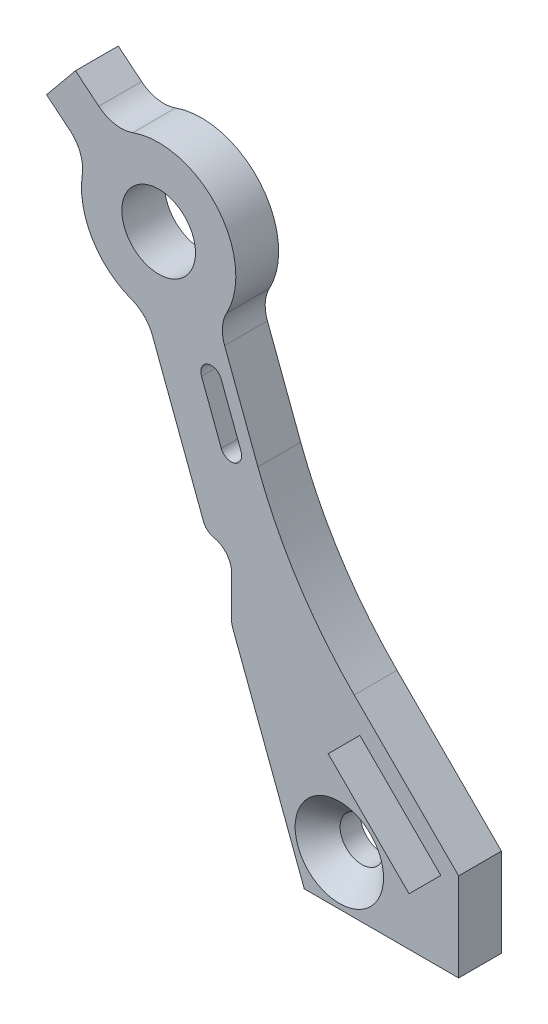
from build123d import *

# Parameters (mm, degrees)
SKETCH1_R           = 1.5
SKETCH1_R_2         = 2.625
BOSS_EXTRUDE1_DEPTH = 3.05
FILLET2_R           = 1.6
FILLET3_R           = 2.5
FILLET4_R           = 30
FILLET5_R           = 1
FILLET6_R           = 0.75


with BuildPart() as part:
    # Sketch1 → Boss-Extrude1 (new body)
    with BuildSketch(Plane.XY):
        with BuildLine():
            Line((-5.172936369, 13.742966599), (0, 0))
            Line((0, 0), (11, 0))
            Line((11, 0), (11, 6.303908615))
            Line((11, 6.303908615), (-1.02081528, 18.324723896))
            Line((-1.02081528, 18.324723896), (-6.124201376, 31.882915925))
            ThreePointArc((-6.124201376, 31.882915925), (-6.290762776, 39.054617678), (-13.40685584, 39.961407754))
            Line((-13.40685584, 39.961407754), (-16.302263716, 42.337468617))
            Line((-16.302263716, 42.337468617), (-18.363969834, 39.82512551))
            Line((-18.363969834, 39.82512551), (-15.468561957, 37.449064647))
            ThreePointArc((-15.468561957, 37.449064647), (-15.176038376, 32.687133516), (-11.271628404, 29.945393026))
            Line((-11.271628404, 29.945393026), (-6.960865313, 18.492966599))
            Line((-6.960865313, 18.492966599), (-5.172936369, 18.492966599))
            Line((-5.172936369, 18.492966599), (-5.172936369, 13.742966599))
        make_face()
        with Locations((2.5, 3.5)):
            Circle(SKETCH1_R, mode=Mode.SUBTRACT)
        Polygon((9.727207794, 5.692209589), (7.517499103, 3.482500897), (7.464466094, 3.429467889), (1.701545827, 9.192388155), (3.964287527, 11.455129855), align=None, mode=Mode.SUBTRACT)
        Polygon((-5.650354628, 23.527354521), (-7.587877527, 28.67478155), (-6.184033792, 29.203196886), (-4.246510893, 24.055769857), align=None, mode=Mode.SUBTRACT)
        with Locations((-10.375858941, 35.371957047)):
            Circle(SKETCH1_R_2, mode=Mode.SUBTRACT)
    extrude(amount=BOSS_EXTRUDE1_DEPTH)

    # Sketch3 → CSK for M3 Flat Head Machine Screw1 (revolve, cut)
    with BuildSketch(Plane(origin=(2.5, 3.5, 3.05), x_dir=(0, -1, 0), z_dir=(1, 0, 0))):
        Polygon((0, 0), (0, 3.05), (1.55, 3.05), (1.55, 1.6), (3.15, 0), align=None)
    revolve(axis=Axis((2.5, 3.5, 9.4), (0, 0, -1)), mode=Mode.SUBTRACT)

    # Fillet2
    fillet2_edges = [part.edges().sort_by_distance(p)[0] for p in [
        (-5.172936369, 18.492966599, 1.525),
    ]]
    fillet(fillet2_edges, radius=FILLET2_R)

    # Fillet3
    fillet3_edges = [part.edges().sort_by_distance(p)[0] for p in [
        (-6.124201376, 31.882915925, 1.525),
        (-11.271628404, 29.945393026, 1.525),
        (-15.468561957, 37.449064647, 1.525),
        (-13.40685584, 39.961407754, 1.525),
    ]]
    fillet(fillet3_edges, radius=FILLET3_R)

    # Fillet4
    fillet4_edges = [part.edges().sort_by_distance(p)[0] for p in [
        (-1.02081528, 18.324723896, 1.525),
    ]]
    fillet(fillet4_edges, radius=FILLET4_R)

    # Fillet5
    fillet5_edges = [part.edges().sort_by_distance(p)[0] for p in [
        (-6.960865313, 18.492966599, 1.525),
        (-5.172936369, 13.742966599, 1.525),
    ]]
    fillet(fillet5_edges, radius=FILLET5_R)

    # Fillet6
    fillet6_edges = [part.edges().sort_by_distance(p)[0] for p in [
        (-4.246510893, 24.055769857, 1.525),
        (-5.650354628, 23.527354521, 1.525),
        (-6.184033792, 29.203196886, 1.525),
        (-7.587877527, 28.67478155, 1.525),
    ]]
    fillet(fillet6_edges, radius=FILLET6_R - 0.0001)  # a hair under: the kernel refuses the full size


solid = part.part
